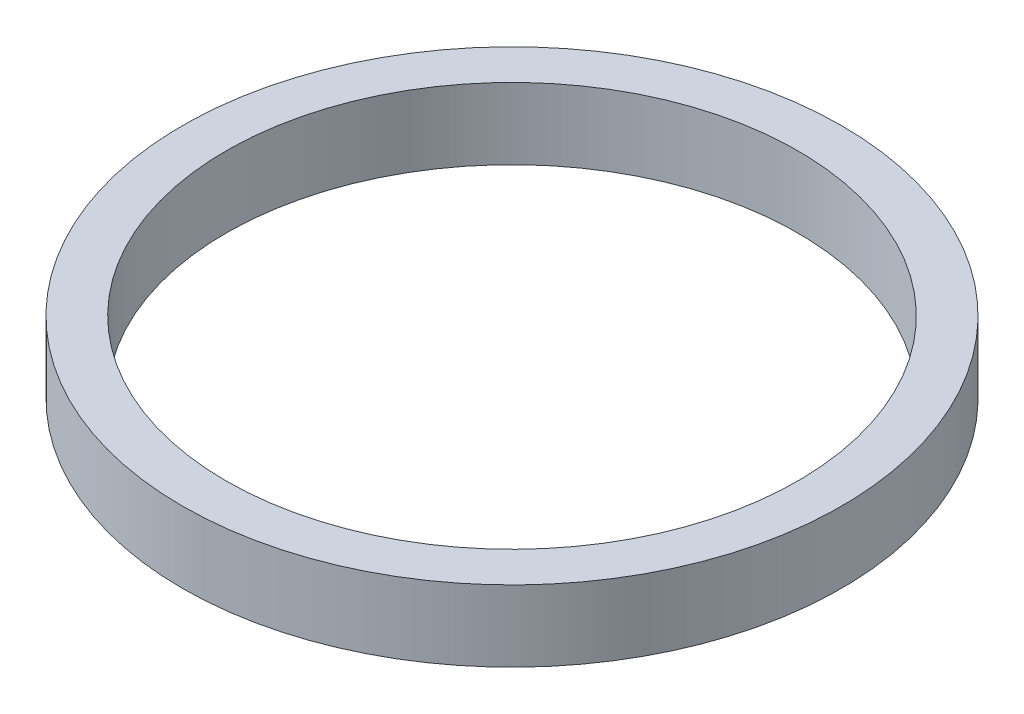
from build123d import *

# Parameters (mm, degrees)
SKETCH2_R           = 18.5
SKETCH2_R_2         = 16.05
BOSS_EXTRUDE1_DEPTH = 4


with BuildPart() as part:
    # Sketch2 → Boss-Extrude1 (new body)
    with BuildSketch(Plane(origin=(0, 9, 0), x_dir=(1, 0, 0), z_dir=(0, 1, 0))):
        with Locations((-0.5, 0)):
            Circle(SKETCH2_R)
        with Locations((-0.5, 0)):
            Circle(SKETCH2_R_2, mode=Mode.SUBTRACT)
    extrude(amount=BOSS_EXTRUDE1_DEPTH)


solid = part.part
